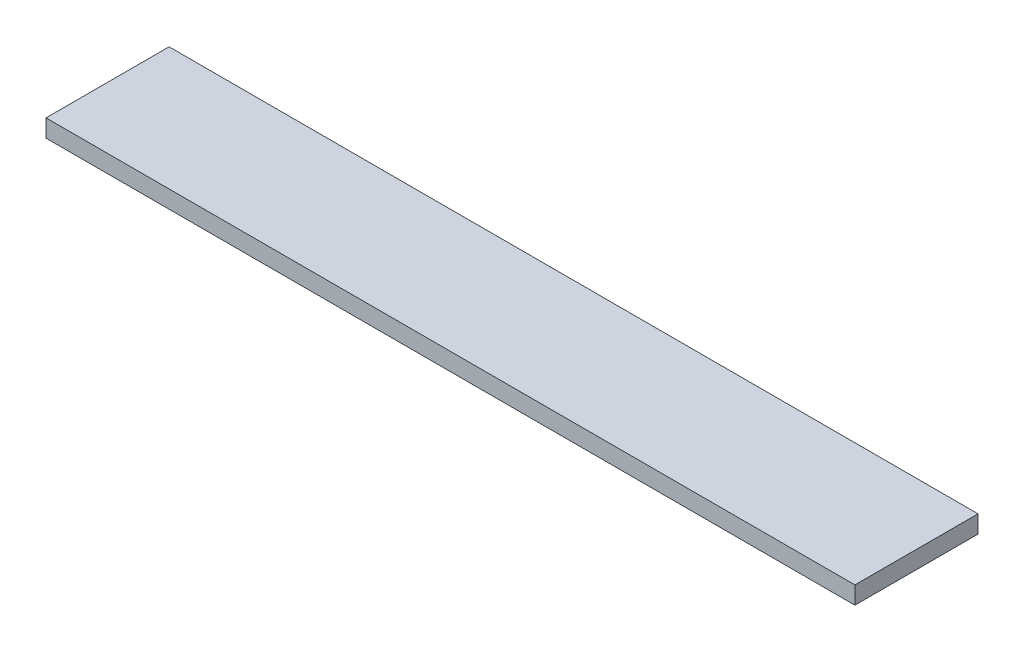
from build123d import *

# Parameters (mm, degrees)
SKETCH1_W           = 230
SKETCH1_H           = 35
BOSS_EXTRUDE1_DEPTH = 2.5


with BuildPart() as part:
    # Sketch1 → Boss-Extrude1 (new, symmetric)
    with BuildSketch(Plane(origin=(0, 0, 0), x_dir=(1, 0, 0), z_dir=(0, 1, 0))):
        Rectangle(SKETCH1_W, SKETCH1_H)
    extrude(amount=BOSS_EXTRUDE1_DEPTH, both=True)


solid = part.part
